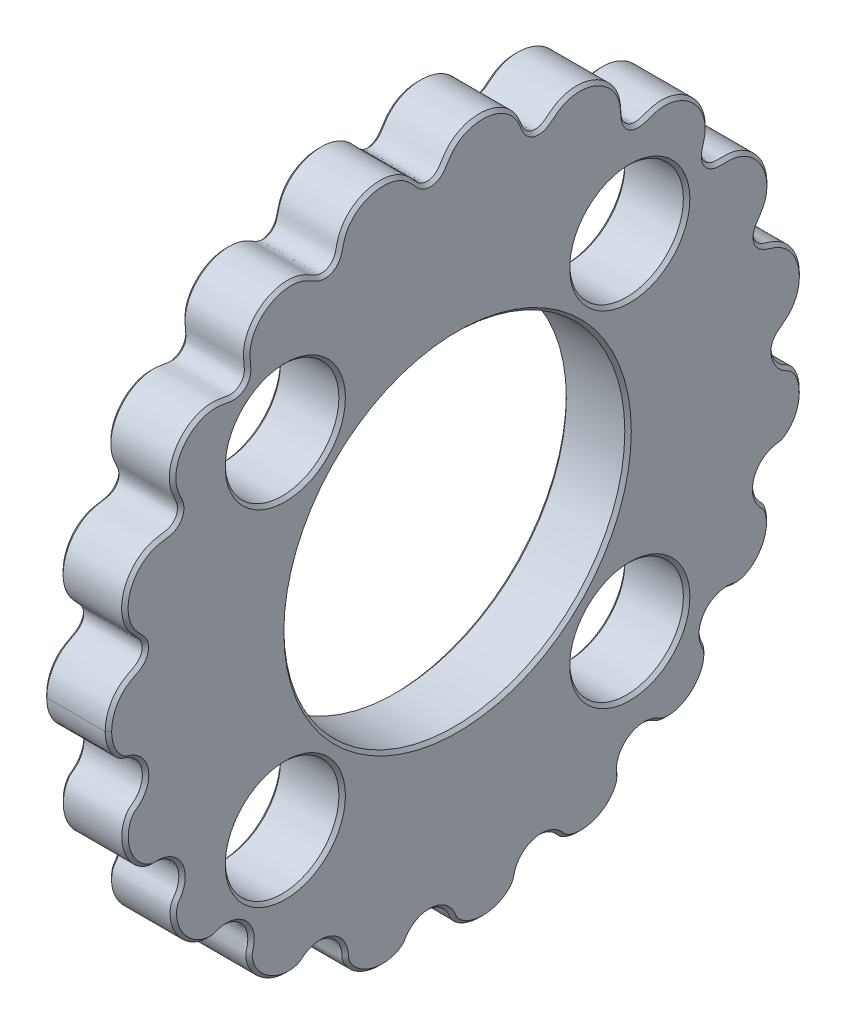
from build123d import *

# Parameters (mm, degrees)
SKETCH3_R           = 3.4999999999999996
SKETCH3_R_2         = 3.4999999999999982
SKETCH3_R_3         = 10.499999999999996
BOSS_EXTRUDE1_DEPTH = 4
CHAMFER1_SIZE       = 0.2


with BuildPart() as part:
    # Sketch3 → Boss-Extrude1 (new body)
    with BuildSketch(Plane(origin=(0, 0, 0), x_dir=(0, 0, -1), z_dir=(1, 0, 0))):
        with BuildLine():
            add(Edge.make_bspline(
                [(19.499999999999975, 3.329884417e-07), (19.499999999999975, -0.02287230945377665), (19.501229996833807, -0.06835144286155047), (19.506764992747904, -0.16754038275533853), (19.521487716763982, -0.2580209971098714), (19.543480268061113, -0.36881297082766035), (19.572630771735337, -0.4664537346469855), (19.60879615142777, -0.567791824809307), (19.651789624711995, -0.6632999383626808), (19.714132288668676, -0.7810693011824871), (19.802123499274355, -0.9144079510635557), (19.905487765368555, -1.0376345734967405), (20.02247229811794, -1.1477140826825898), (20.127883830321927, -1.23026548489148), (20.21638550502787, -1.2903536252035084), (20.309627016582475, -1.3451569315202483), (20.406485287855816, -1.394770335242422), (20.50719465216759, -1.4399198443744707), (20.59860271403629, -1.5037334733794454), (20.702594511579242, -1.5958084287050176), (20.813570665973955, -1.7204619686803277), (20.951910949920784, -1.9188697785914708), (21.091865071365625, -2.2037345686619907), (21.199089135309986, -2.5524694076271164), (21.252984017900896, -2.9607634620627894), (21.24195814277644, -3.3883117410404178), (21.159648671579774, -3.824579259899284), (20.999344174619836, -4.256158112798461), (20.78466013547445, -4.613893456089248), (20.551841067158822, -4.88465713142394), (20.319649860063095, -5.08204728659998), (20.147971438508993, -5.190189950025972), (20.0018465576917, -5.256235887602332), (19.88904249956997, -5.2886297800237925), (19.823016743996046, -5.300039515099961), (19.739803315911633, -5.309103893813168), (19.64034520844874, -5.322957876235482), (19.492613380585045, -5.353200067350046), (19.239603757466135, -5.43439155832235), (18.919287115207638, -5.613441115160358), (18.60866084535488, -5.9328746437024185), (18.399823038818454, -6.3710126916030125), (18.343377121818513, -6.772942029709708), (18.375358623535757, -7.097589519220558), (18.45239445057881, -7.357772668787995), (18.54327055448347, -7.55600780539964), (18.647619250972834, -7.7182570063137685), (18.75381430830691, -7.848236946865188), (18.85335026917537, -7.950082777091329), (18.938836225776676, -8.031385638833923), (19.005706643286548, -8.129006847120406), (19.06174796371881, -8.232343669920137), (19.11937144698086, -8.367851309748609), (19.185265309742054, -8.581297131572022), (19.231642426441926, -8.878251232050761), (19.227170867023894, -9.255241834436665), (19.149158342009496, -9.671630553658584), (19.001308503593624, -10.080304128009578), (18.783632002674665, -10.469626684813424), (18.496493654796822, -10.825786264185021), (18.141045028345413, -11.131991655470824), (17.806174446906024, -11.320269007481196), (17.52454050640761, -11.418108716242509), (17.316091860878064, -11.45561326874725), (17.18986873175847, -11.46592728562895), (17.062758742075072, -11.459868508465133), (16.93988492706201, -11.42793666140127), (16.784020037465467, -11.4013350279623), (16.59434373397104, -11.386250091096047), (16.372156605715546, -11.399323200639946), (16.061985501982278, -11.469436337301536), (15.728730478959532, -11.628186639375828), (15.410197064764583, -11.902601814291726), (15.166005134049836, -12.300372052313278), (15.066077010775238, -12.681240584481177), (15.0616536901558, -13.015215128468423), (15.105851881600806, -13.261803650430771), (15.15562664186265, -13.424752302557744), (15.205208549053072, -13.545300702443578), (15.243694405135681, -13.627115099206286), (15.285251390684238, -13.70745604639544), (15.329873493367348, -13.81984404953803), (15.361074000114298, -13.983771877870042), (15.371794431908645, -14.244097798114561), (15.323416880416595, -14.581476394351373), (15.201774992133414, -14.951545153750885), (14.99175036538002, -15.336511927592221), (14.718830007551794, -15.682935730194636), (14.390617047628089, -15.98218507810921), (14.015057318833543, -16.22478425264884), (13.652056551315157, -16.378363309697612), (13.32472090763043, -16.45957380099728), (13.070361999580625, -16.485893510599173), (12.895997979484859, -16.486004406743366), (12.74704726487107, -16.472470459398583), (12.624835044777388, -16.449694476259985), (12.504412844827472, -16.416564745005726), (12.391429717243987, -16.363425285131033), (12.287613402425322, -16.294480746837987), (12.176937157346304, -16.23746528153187), (12.063868167458645, -16.186368642835397), (11.946934261535072, -16.145506244843272), (11.797961603721701, -16.105613765227478), (11.615118661304155, -16.077373586776393), (11.398949112941555, -16.073126794497604), (11.100418616109161, -16.116088884477946), (10.764457394901738, -16.239773814236155), (10.427112842736264, -16.476626459818625), (10.179140928681162, -16.799355585111762), (10.044124624260599, -17.11593592514342), (9.984496226705057, -17.397811379174257), (9.973476180271238, -17.603154360238936), (9.983571034344273, -17.782493573097717), (10.009341888941961, -17.934290692396118), (10.00957383817889, -18.057736310768114), (9.990903990195946, -18.179613409453303), (9.961966157281509, -18.2990758472193), (9.914245299234244, -18.439532528296297), (9.84376902903685, -18.59807926549862), (9.717135199083561, -18.819436426286828), (9.510830090515586, -19.085644126481), (9.224157164160713, -19.355362950704), (8.850924927445984, -19.600943239878582), (8.444639131404681, -19.78061484299426), (8.017244402371128, -19.890606402995026), (7.57943319567193, -19.927435877585285), (7.192037901027372, -19.88893383945879), (6.86451007596446, -19.79712618264644), (6.632454357306686, -19.682256128355874), (6.48341495441103, -19.580510796517043), (6.382788785125926, -19.469549559264163), (6.308485908373052, -19.37634572204253), (6.204919184378785, -19.271305758406694), (6.072508879873373, -19.156566051379514), (5.9023225647692925, -19.04438638394573), (5.692407193251576, -18.946696326708174), (5.417395778581255, -18.866879606389183), (5.076052473850909, -18.838435231274907), (4.6712911634664005, -18.906330989559837), (4.302086158066921, -19.094844905106537), (4.034142539023349, -19.336334520539918), (3.853010610427224, -19.588406948647325), (3.755341977838242, -19.785065867178943), (3.694182483712389, -19.964964684285803), (3.6578592740915887, -20.121051554131384), (3.635894637654867, -20.247879930943043), (3.585508678111304, -20.3668849085039), (3.5231479058070163, -20.478837562207463), (3.434875642737918, -20.60527031078799), (3.317643343211058, -20.741360684202036), (3.1251919288314745, -20.921086387908247), (2.8392828135351, -21.11816851414157), (2.4722091893724745, -21.29119263577315), (2.031759555694021, -21.40903047716956), (1.5853149683359111, -21.450666171764972), (1.1456960982147835, -21.419100910302227), (0.7241735900222745, -21.3170885615711), (0.3735603176483722, -21.162017952178232), (0.09633428657242522, -20.977589398638106), (-0.08680452733857426, -20.803325310099783), (-0.19544179310044416, -20.66772569586649), (-0.2653119008589742, -20.54092414934849), (-0.30233114028752284, -20.43131288545926), (-0.35824742929314773, -20.302235215530832), (-0.4357067978776058, -20.15506717176089), (-0.5755406378212916, -19.952248783705326), (-0.8095816757843036, -19.72014391409475), (-1.142868041125582, -19.520053001138848), (-1.5298184705020847, -19.420943711717598), (-1.8832789977994735, -19.42158623736495), (-2.1823651942007993, -19.486265155674097), (-2.423535952495873, -19.58373122352189), (-2.6177454107348668, -19.703999966243686), (-2.7683413820419775, -19.82998751872537), (-2.8818924912930473, -19.94899706554997), (-2.9651005057896285, -20.052610873501113), (-3.0307630587168473, -20.148613685323816), (-3.08151040322101, -20.234272585462357), (-3.131848560635136, -20.32031883761394), (-3.214884461194451, -20.424537908796303), (-3.346299205858954, -20.54128742291917), (-3.5280915812365925, -20.660730993950878), (-3.8009481818691504, -20.789644131384872), (-4.139644055507957, -20.890292758555983), (-4.549510793861524, -20.94029617448333), (-5.00551738543772, -20.912353008594433), (-5.435917489994843, -20.811915761514957), (-5.831023879190455, -20.64968846453274), (-6.1835425843164895, -20.435018746913816), (-6.460207870643753, -20.194912777958276), (-6.647120269286063, -19.971559143659356), (-6.762049142269534, -19.789026588639803), (-6.825880108205394, -19.6633735330485), (-6.8684250036017875, -19.55901418125623), (-6.901973685666203, -19.451232038409113), (-6.92026589168495, -19.339620336012583), (-6.920173001232836, -19.22724828289659), (-6.928704794366817, -19.115996412471333), (-6.943160525530169, -19.005776139105148), (-6.965329085273686, -18.897404103832024), (-7.002307046620191, -18.764150583562586), (-7.061779675708556, -18.609031023016993), (-7.175965058673441, -18.393049986947865), (-7.378247895741575, -18.14050775470517), (-7.645599848258114, -17.932626455281806), (-7.966531643255652, -17.791503281727945), (-8.27264790584938, -17.729172159856603), (-8.54789129233259, -17.72378091691189), (-8.786232549815997, -17.76238696985816), (-8.983100683316987, -17.825871767099382), (-9.140304380626015, -17.897767499621196), (-9.26047781998533, -17.967098403776983), (-9.375575351944832, -18.045386087981054), (-9.48143911925773, -18.13468588388963), (-9.586713163091648, -18.22609092843788), (-9.711477076833708, -18.289392353086395), (-9.865933829664995, -18.34958827280036), (-10.054475723662359, -18.395508671600396), (-10.273445100505931, -18.42263427894083), (-10.521727136537752, -18.422182512047726), (-10.82971697287408, -18.387728810370554), (-11.190998674918708, -18.295757541594018), (-11.586257671859638, -18.12438451349737), (-11.991382994223756, -17.852404669274613), (-12.337865088762689, -17.515590002026826), (-12.578866222447154, -17.17326881571032), (-12.732815698293201, -16.849302206869837), (-12.80912259266666, -16.58794576442956), (-12.84103459750453, -16.403083339756463), (-12.847679287775279, -16.242140287545844), (-12.840761965686314, -16.105385156968442), (-12.80115457728268, -15.974963852637913), (-12.762013705584204, -15.845140218900319), (-12.736108441845145, -15.711523066009692), (-12.71997789938583, -15.57669305040338), (-12.713331409270031, -15.340927125925848), (-12.762020601887702, -15.006217868071076), (-12.9286864261791, -14.623262867838669), (-13.26030087815191, -14.261201570820521), (-13.613146217406253, -14.058519528284544), (-13.92282662020868, -13.967701296866128), (-14.187385328162115, -13.941527352050644), (-14.397855418595046, -13.949450571562442), (-14.581906116649622, -13.982146863109538), (-14.738924506498678, -14.027589117810132), (-14.868797074620577, -14.078662992494792), (-14.977192266389975, -14.1216945454198), (-15.092608189700728, -14.14098819217288), (-15.208431572086543, -14.149737854486958), (-15.35400991538781, -14.146747254488927), (-15.57423420237398, -14.120318419361094), (-15.863086159833246, -14.04262991477303), (-16.204884402208197, -13.886646225508564), (-16.553550281083545, -13.647579797719015), (-16.86756211126879, -13.347676631778306), (-17.13588532252412, -12.991497716773303), (-17.346253094355273, -12.58461232318562), (-17.482747856441662, -12.135106428143247), (-17.523256638752237, -11.717850667267141), (-17.487234024737916, -11.385554866974205), (-17.413712398587663, -11.147426152473336), (-17.33559821232397, -11.00256950750292), (-17.253192390951995, -10.90010723447597), (-17.166172202876048, -10.761181773114924), (-17.07751875825349, -10.58764851280511), (-17.004828389567308, -10.37331140898559), (-16.95300874861338, -10.056860304669218), (-16.975391204152174, -9.690767044899282), (-17.107962810258105, -9.297630771737959), (-17.381469359202562, -8.922309600522842), (-17.69476643099147, -8.684402412326083), (-18.0059259381502, -8.55165938496039), (-18.257676816779696, -8.498334067189338), (-18.430446760403353, -8.483957464294454), (-18.576830850067402, -8.48325196098362), (-18.696291074800936, -8.49415572785092), (-18.8459694927804, -8.48221541688931), (-19.02004153909573, -8.435093126186842), (-19.256538583701825, -8.334829457894966), (-19.53726778118809, -8.152387022870135), (-19.81769794022687, -7.8935544529872335), (-20.076625840973932, -7.551951342289513), (-20.279715365235734, -7.166455873544541), (-20.42006314008765, -6.745751337354278), (-20.48985493506592, -6.300112567856838), (-20.481207653638876, -5.898539389469338), (-20.41882324316543, -5.560608917507923), (-20.33547822043518, -5.314848800218689), (-20.26181606621446, -5.155649741774989), (-20.18683456315623, -5.026668344797717), (-20.115256615631896, -4.927695857285754), (-20.035301545087677, -4.834002138855096), (-19.938127904103897, -4.759051473020707), (-19.836535895980912, -4.6909346407148345), (-19.74220358147565, -4.612674644960762), (-19.629186308621218, -4.507082785343819), (-19.50701907935731, -4.364923014997262), (-19.386941886623255, -4.180461545036984), (-19.286031302679188, -3.9488024878385137), (-19.21507388614972, -3.66554573585125), (-19.200220223221887, -3.3332205248544136), (-19.261569524551692, -3.016369627364003), (-19.38725984376836, -2.73305170616435), (-19.532693662047194, -2.51971622560051), (-19.67196666781302, -2.3656631083957094), (-19.830448110538104, -2.2321352018664657), (-19.983343951462615, -2.135243323393579), (-20.12212868286469, -2.0670562094287206), (-20.241814201843074, -2.0206668304555326), (-20.339172229997047, -1.9882049474646957), (-20.438748674397267, -1.9626339568977524), (-20.534065822701155, -1.923748993362187), (-20.635086506707566, -1.8649215199069444), (-20.74106041224381, -1.7883776534031404), (-20.878831902993692, -1.6656828585839336), (-21.03572293542551, -1.4859662871936574), (-21.189282899599437, -1.2540200026231705), (-21.314003440789445, -0.9913255997274952), (-21.398890221573467, -0.7437177135429477), (-21.44734116004922, -0.5393203026336444), (-21.47334392820881, -0.38841130372841975), (-21.488342226553048, -0.2556119762425632), (-21.496335931475116, -0.1623452446439793), (-21.4993338223915, -0.06761080760295489), (-21.49999999919133, -0.02242027775518435), (-21.50000000000001, 2.363204427e-07)],
                knots=[0.06742672404055065, 0.06742672404055065, 0.06742672404055065, 0.06742672404055065, 0.06742672404055065, 0.06857526503569406, 0.0697238102110965, 0.07087235538649893, 0.07202090056190136, 0.07316944573730379, 0.07431799091270622, 0.07546653608810866, 0.07661508126351109, 0.07894233574718174, 0.08126959023085238, 0.0824332174726877, 0.08359684471452303, 0.08476047195635836, 0.08592409919819367, 0.08713122716345095, 0.08833835512870825, 0.08954548309396552, 0.0907526110592228, 0.09316686698973738, 0.09558112292025195, 0.1000416543963477, 0.10450218587244345, 0.10896271734853921, 0.11342324882463496, 0.11857825663663443, 0.12373326444863392, 0.12888827226063337, 0.13146577616663313, 0.13404328007263286, 0.13695584131741328, 0.1376839816286084, 0.1384121219398035, 0.13914026225099863, 0.1398684025621937, 0.1413246831845839, 0.14278096380697414, 0.14569352505175456, 0.15140029479194717, 0.1571070645321398, 0.16178427475767204, 0.16646148498320432, 0.16882523086595524, 0.1711889767487062, 0.17355272263145716, 0.1759164685142081, 0.17719549018423109, 0.17847451185425406, 0.17975353352427703, 0.18103255519429998, 0.18231157686432292, 0.1835905985343459, 0.18614864187439184, 0.19073523879291113, 0.1953218357114304, 0.1999084326299497, 0.204495029548469, 0.2095679897677511, 0.21464094998703323, 0.21971391020631537, 0.22478687042559747, 0.22616281853657844, 0.22753876664755943, 0.22891471475854042, 0.23029066286952138, 0.23166661098050237, 0.23304255909148336, 0.2357944553134453, 0.23855039436209224, 0.2413063334107392, 0.24681821150803313, 0.2516809340381474, 0.2565436565682617, 0.2613203417364751, 0.2637086843205818, 0.2660970269046885, 0.2674083132727255, 0.2687195996407626, 0.2693752428247811, 0.27003088600879965, 0.27134217237683667, 0.27396474511291075, 0.2765873178489848, 0.2813322149876236, 0.2860771121262624, 0.2908220092649012, 0.29556690640354005, 0.3004401960403346, 0.3053134856771292, 0.31018677531392375, 0.31262342013232103, 0.3150600649507183, 0.3164128024351728, 0.3177655399196273, 0.31911827740408183, 0.32047101488853635, 0.3218237523729909, 0.32317648985744535, 0.3245292273418998, 0.32588196482635434, 0.3272201077931269, 0.3285582507598994, 0.3312345366934445, 0.33391082262698957, 0.3365871085605347, 0.3416252435854473, 0.3466633786103599, 0.3515704326854172, 0.35402395972294587, 0.3564774867604746, 0.3591511919083717, 0.36048804448232025, 0.3618248970562688, 0.36316174963021736, 0.3644986022041659, 0.36583545477811447, 0.367172307352063, 0.36960559809489724, 0.3720388888377315, 0.37690547032339994, 0.38177205180906837, 0.3866386332947368, 0.39139111659385917, 0.3961435998929816, 0.400896083192104, 0.4056485664912264, 0.4082442458006671, 0.4108399251101078, 0.41213776476482816, 0.4134356044195485, 0.41473344407426893, 0.4160312837289893, 0.4185416079647096, 0.42105193220042997, 0.4235622564361503, 0.42607258067187065, 0.4309509207383144, 0.4358292608047582, 0.4411584116370564, 0.4438229870532055, 0.4464875624693546, 0.4492775570138713, 0.4506725542861296, 0.45206755155838796, 0.4534625488306463, 0.45485754610290463, 0.45625254337516297, 0.45764754064742136, 0.4601553894641598, 0.46266323828089817, 0.46767893591437504, 0.47269463354785185, 0.47771033118132866, 0.48240406415202886, 0.4870977971227291, 0.49179153009342935, 0.49648526306412955, 0.498994178475154, 0.5015030938861784, 0.5027575515916907, 0.5040120092972029, 0.5052664670027152, 0.5065209247082273, 0.5088783059872031, 0.511235687266179, 0.5159504498241307, 0.5207535976574469, 0.5255567454907629, 0.5283726046762773, 0.5311884638617919, 0.5340043230473064, 0.5368201822328208, 0.5382643529712738, 0.539708523709727, 0.5411526944481801, 0.5425968651866333, 0.5433189505558599, 0.5440410359250865, 0.5454852066635395, 0.5483735481404457, 0.5509246293965806, 0.5534757106527154, 0.5585778731649851, 0.5636800356772547, 0.5687821981895244, 0.5732521832581763, 0.5777221683268283, 0.5821921533954802, 0.5866621384641322, 0.5891123215379016, 0.5903374130747863, 0.591562504611671, 0.5927875961485558, 0.5940126876854406, 0.5952377792223253, 0.59646287075921, 0.5976652946988608, 0.5988677186385114, 0.600070142578162, 0.6012725665178127, 0.603677414397114, 0.6060822622764153, 0.6106631674611567, 0.615244072645898, 0.6182230161327041, 0.6212019596195103, 0.6241809031063165, 0.6271598465931226, 0.6286691050530335, 0.6301783635129445, 0.6316876219728556, 0.6331968804327666, 0.6347061388926776, 0.6362153973525886, 0.6377246558124996, 0.6392339142724105, 0.6419265674782795, 0.6446192206841485, 0.6473118738900174, 0.6500045270958864, 0.6553898335076244, 0.6607751399193623, 0.665949490608613, 0.6711238412978637, 0.6762981919871145, 0.6788853673317399, 0.6814725426763651, 0.6829491778619678, 0.6844258130475706, 0.6859024482331733, 0.687379083418776, 0.6888557186043787, 0.6903323537899814, 0.6918089889755841, 0.6932856241611868, 0.6991032806094032, 0.7049209370576196, 0.709604404162876, 0.7142878712681324, 0.7165710868699332, 0.718854302471734, 0.7211375180735349, 0.7234207336753357, 0.7246852719645209, 0.7259498102537062, 0.7272143485428915, 0.7284788868320767, 0.729743425121262, 0.7310079634104473, 0.7335370399888178, 0.7381145370682876, 0.7426920341477573, 0.7472695312272271, 0.7518470283066968, 0.7569288245846095, 0.7620106208625221, 0.7670924171404349, 0.7721742134183476, 0.775024564777769, 0.7764497404574797, 0.7778749161371905, 0.7793000918169013, 0.780725267496612, 0.7835756188560334, 0.7863363225385618, 0.78909702622109, 0.7946184335861466, 0.7993584426313578, 0.8040984516765689, 0.8090262042093547, 0.8114900804757476, 0.8139539567421404, 0.8152549575783476, 0.816555958414555, 0.8178569592507622, 0.8191579600869694, 0.8217599617593839, 0.8243619634317985, 0.829001152159631, 0.8336403408874634, 0.8382795296152958, 0.8429187183431284, 0.8478834856311608, 0.8528482529191932, 0.8578130202072256, 0.8602954038512418, 0.862777787495258, 0.8641084690219264, 0.8654391505485948, 0.8667698320752633, 0.8681005136019316, 0.8694311951286, 0.8707618766552685, 0.8720925581819369, 0.8734232397086052, 0.8761587571369028, 0.8788942745652004, 0.8816297919934979, 0.8843653094217955, 0.8888081568321564, 0.8932510042425174, 0.8955032308718964, 0.8977554575012754, 0.9000076841306544, 0.9022599107600334, 0.9044925212387498, 0.9056088264781079, 0.9067251317174662, 0.9078414369568244, 0.9089577421961825, 0.9100740474355407, 0.9111903526748989, 0.9129145394165368, 0.9146387261581745, 0.9180870996414503, 0.9215354731247261, 0.9249838466080017, 0.927235529887418, 0.9294872131668341, 0.9306130548065422, 0.9317388964462503, 0.9328647380859585, 0.9339905767545582, 0.9339905767545582, 0.9339905767545582, 0.9339905767545582, 0.9339905767545582], degree=4))
            add(Edge.make_bspline(
                [(19.499999999999975, 3.329884417e-07), (19.499999999980815, 0.00693842470733998), (19.500217496612237, 0.02084398732890852), (19.501196230422288, 0.04535259060889237), (19.503804156988494, 0.08108974752194885), (19.508687587126204, 0.12397791655168573), (19.5171325954883, 0.17182890460717695), (19.530716992951426, 0.22761196082915336), (19.55124596851782, 0.29051486057064596), (19.58295791231204, 0.3664476583420515), (19.632560045278172, 0.45776894040639543), (19.706316311620355, 0.5592306318832981), (19.80828422294335, 0.6647301114799387), (19.924139742492635, 0.7620737974095453), (20.044931667400636, 0.8530290513215487), (20.16657512526189, 0.9427943210082822), (20.3161553658492, 1.058343634403528), (20.50512010342224, 1.2221658201638395), (20.716743334349797, 1.4511966749048153), (20.92494756108271, 1.7610347237302675), (21.090421670407405, 2.1210692105232236), (21.199642877569644, 2.5032566174525193), (21.252187173660605, 2.8984848944590595), (21.247216241110653, 3.398919315169449), (21.148688774624635, 3.893024712250063), (20.959864578852134, 4.360515771175375), (20.685169940924876, 4.780627103191222), (20.41689174888264, 5.0797147098194015), (20.120347739854072, 5.317693101389944), (19.810040617992396, 5.496492786086577), (19.497558229816832, 5.6208796578165146), (19.1986133128946, 5.713345121470486), (18.8465112314293, 5.827838442910737), (18.49925241367852, 6.092672871650264), (18.344615618627596, 6.519701093682414), (18.436442116411474, 6.94006086964333), (18.630740950018613, 7.244026950844603), (18.804689568619878, 7.48950897317587), (18.9759879594926, 7.7672402101048705), (19.118202500931382, 8.086110274094308), (19.243025856126366, 8.541380356968533), (19.274262823820973, 9.140718664061694), (19.136728192700698, 9.832696058706286), (18.76645079809617, 10.550875997226516), (18.27933265294612, 11.067498932408798), (17.768008717120146, 11.393446026493388), (17.316423675962795, 11.559072188751587), (16.964948565714025, 11.62937293227197), (16.62898091487679, 11.647170537397812), (16.315766250680795, 11.638299788413033), (15.945777286851971, 11.630148272576497), (15.52937104603442, 11.761437960013332), (15.239362742798773, 12.110870526511581), (15.183057657741248, 12.537350069610955), (15.26533973663865, 12.88863012661935), (15.350485276220857, 13.176752005496049), (15.423596350119952, 13.494502853617115), (15.456583859355717, 13.841694104628896), (15.429595645004722, 14.312578172728783), (15.267891695377866, 14.89026730718507), (14.91635743161823, 15.501968403366128), (14.335650569855632, 16.06410333490407), (13.708473254068284, 16.397937476266844), (13.119405778748062, 16.543391567330378), (12.638306374068451, 16.556087075281702), (12.282497923882401, 16.51042131131493), (11.958397710715197, 16.419657850458144), (11.664379803829936, 16.310180884041333), (11.317877512287938, 16.18057410504068), (10.87910312243113, 16.162728671419956), (10.48819974847597, 16.395259562990194), (10.293721721264896, 16.775721320225312), (10.254290935644356, 17.128733017486965), (10.241646233814267, 17.41819818690422), (10.21160887256101, 17.73648905318031), (10.136067329393963, 18.075232788552807), (9.962722431864162, 18.51920794788478), (9.620188259643484, 19.027594885561268), (9.0784812614239, 19.505653549615488), (8.422010234571045, 19.81173010860383), (7.811990770711981, 19.933244702131777), (7.296006302536649, 19.93120030439843), (6.888373946240667, 19.865132783915357), (6.52148679126579, 19.739931912853894), (6.201923124750547, 19.57117424404322), (5.9298582267630975, 19.374256239100237), (5.693555686777136, 19.176345817658884), (5.400578007027449, 18.948300997838764), (4.983454623436344, 18.81834446021791), (4.548512421187868, 18.939159842622804), (4.262200305553063, 19.25203112035506), (4.121443757509707, 19.570751032185726), (4.014653368284693, 19.839222652347708), (3.8811203556175062, 20.124619759461698), (3.6990480653827356, 20.411279426887408), (3.3965132902621997, 20.76047159029014), (2.9201329512612513, 21.118301529438835), (2.2690963433259266, 21.390467328944826), (1.4617236492352024, 21.48360162858222), (0.7523981091332773, 21.36295146724718), (0.19105171874955434, 21.113372786554592), (-0.20186857994289573, 20.822820175287607), (-0.45822645338408513, 20.5621275342276), (-0.6614118219291472, 20.283311312651712), (-0.8286864890205424, 20.007961921989644), (-1.0321210490714936, 19.687405529281904), (-1.3848271605621605, 19.42072262269646), (-1.8361578652262855, 19.388512375354846), (-2.2097935607661405, 19.584645273023128), (-2.448259267672147, 19.838746090971338), (-2.635832085688203, 20.057913830827104), (-2.853681862636474, 20.285248349661043), (-3.1174274749842543, 20.498544650408252), (-3.5152331031791646, 20.732718444809944), (-4.08069419734254, 20.91962133410803), (-4.7845741206372745, 20.969382918037926), (-5.579511099898053, 20.79929438960938), (-6.213315427175049, 20.45784411012257), (-6.665679174959722, 20.04163337963896), (-6.945324867456741, 19.640569062231137), (-7.105150994089426, 19.311403548249153), (-7.208343471111343, 18.982073145989713), (-7.27806364825163, 18.667117745667547), (-7.364050911489696, 18.29750402493643), (-7.605244850181123, 17.927059120369883), (-8.019022643798959, 17.743992364504443), (-8.436932641415886, 17.801693301599165), (-8.74624796758815, 17.962241978412525), (-8.994271646617971, 18.108734307628783), (-9.273329996621937, 18.254038315266502), (-9.591001538906541, 18.371859591368764), (-10.04234252965673, 18.466740075209508), (-10.63763111593939, 18.46331092903898), (-11.320484134644015, 18.285439823975118), (-12.019404321698618, 17.8698820388962), (-12.51092490914557, 17.343282871377237), (-12.806643916882644, 16.803964713908424), (-12.943566188352968, 16.334317622977114), (-12.98995502648169, 15.97109224142213), (-12.982226136903332, 15.625883042600517), (-12.946748086413796, 15.304946614949458), (-12.905899134173172, 14.92769273221419), (-13.007698204421342, 14.495066863836652), (-13.341529614351433, 14.178771425630893), (-13.765602858742863, 14.095848374726424), (-14.122019870722383, 14.152562907361084), (-14.416771548819458, 14.21313123775004), (-14.740131106304935, 14.257981007429091), (-15.089370885008895, 14.259447645405189), (-15.55645715040743, 14.18994410533143), (-16.117528667178437, 13.976706462752079), (-16.695268657222638, 13.571770076292996), (-17.20310822897515, 12.943383333250695), (-17.47939079450813, 12.289433575682558), (-17.57141175489553, 11.690210319854735), (-17.540807665737287, 11.210272338574299), (-17.463361305741717, 10.860404560450737), (-17.344232289623097, 10.545805415001936), (-17.210110009056365, 10.262774748113118), (-17.054626325433254, 9.926881441854363), (-17.009810848029023, 9.492537083740167), (-17.215303642259993, 9.087565687350907), (-17.58442658437556, 8.86659363296209), (-17.93934213722821, 8.801800412740864), (-18.23751595839309, 8.763871661371516), (-18.557876326798468, 8.702726989401258), (-18.888977878919306, 8.592778533662061), (-19.309074540900067, 8.378030369933894), (-19.772479969345497, 7.996955978735749), (-20.190470364941472, 7.428575885998858), (-20.470647714812685, 6.670559962529333), (-20.523285281125922, 5.9621637777578105), (-20.418748746785838, 5.364588201330365), (-20.236468803487703, 4.919333020403192), (-20.050937335877048, 4.61225920413803), (-19.837718218216036, 4.352301022310232), (-19.61847011241818, 4.127285967783315), (-19.36220565725631, 3.8615995868381594), (-19.20063708707543, 3.529542581937176), (-19.210414492495975, 3.169559752244185), (-19.355179893043264, 2.86362626171498), (-19.545778489229228, 2.6644443272382903), (-19.780935730568004, 2.5221249782632946), (-20.030497647977846, 2.3995739639614526), (-20.300436338569458, 2.2534621249768936), (-20.576884887312872, 2.0610168652995298), (-20.842888201763948, 1.809187470498787), (-21.081966735248866, 1.4945771890326698), (-21.25182688618291, 1.1796839348993122), (-21.355393957632238, 0.9098613241483707), (-21.41520859771544, 0.6968197262666985), (-21.447971461550143, 0.5480101909074345), (-21.468948068282394, 0.4257561591410603), (-21.482723022568727, 0.3230992809710346), (-21.49125103680255, 0.22462863754031046), (-21.4971564094585, 0.1474544293106524), (-21.49934383454956, 0.06439894242292343), (-21.49999999904583, 0.02579504746763896), (-21.50000000000001, 2.363204427e-07)],
                knots=[0.07919164041425533, 0.07919164041425533, 0.07919164041425533, 0.07919164041425533, 0.07919164041425533, 0.07954295364376676, 0.07989426830850435, 0.08024558297324193, 0.0805968976379795, 0.08129952696745467, 0.08200215629692983, 0.082704785626405, 0.08340741495588017, 0.08481267361483048, 0.08642608145415093, 0.08803948929347138, 0.08965289713279183, 0.09126630497211227, 0.09287971281143273, 0.09449312065075317, 0.09771993632939407, 0.10193126133076348, 0.10614258633213289, 0.11035391133350231, 0.11456523633487171, 0.11883470746178637, 0.12310417858870104, 0.13164312084253038, 0.13591263338709916, 0.14018214593166795, 0.14445165847623673, 0.1487211710208055, 0.15206799520643066, 0.15541481939205581, 0.15876164357768097, 0.1621084677633061, 0.16780702221667357, 0.17342292791498046, 0.17664666444965893, 0.1798704009843374, 0.18309413751901588, 0.18631787405369435, 0.19052518660978912, 0.19473249916588392, 0.2031471242780735, 0.21169144848299792, 0.22023577268792233, 0.22878019389263154, 0.23305240449498615, 0.23732461509734074, 0.2406735886291485, 0.2440225621609563, 0.2473715356927641, 0.2507205092245719, 0.2564224270404676, 0.26203320891282017, 0.2652538905200952, 0.26847457212737025, 0.2716952537346453, 0.2749159353419204, 0.27911925275494354, 0.2833225701679667, 0.291729204994013, 0.30027888664676383, 0.3088285682995146, 0.31737835948164284, 0.3216532550727069, 0.32592815066377107, 0.32927926964628984, 0.33263038862880867, 0.33598150761132745, 0.3393326265938462, 0.34503787483414977, 0.35075541042614744, 0.35386120233687657, 0.3569669942476057, 0.3600727861583348, 0.363178578069064, 0.36746181607254214, 0.3717450540760202, 0.38031153008297636, 0.38908681339632445, 0.39786209670967254, 0.4022497774658297, 0.4066374582219869, 0.4110251389781441, 0.4154128197343012, 0.41871263659861, 0.4220124534629188, 0.4253122703272276, 0.4286120871915365, 0.4344668928573786, 0.43998563270963376, 0.44307803358580744, 0.4461704344619811, 0.4492628353381548, 0.45235523621432844, 0.45648994213715627, 0.4606246480599841, 0.46889405990563976, 0.477549252963707, 0.48620444602177415, 0.494859792127854, 0.49918746518089396, 0.5035151382339339, 0.5069630446710167, 0.5104109511080994, 0.5138588575451822, 0.517306763982265, 0.5230823093060973, 0.5285960205970318, 0.5316854299994707, 0.5347748394019096, 0.5378642488043486, 0.5409536582067874, 0.5450844313155797, 0.549215204424372, 0.5574767506419566, 0.566137173509554, 0.5747975963771512, 0.583458173220651, 0.5877884616424007, 0.5921187500641506, 0.5955687751366694, 0.5990188002091881, 0.6024688252817068, 0.6059188503542255, 0.6116976972398587, 0.6172063975345895, 0.6202928453055288, 0.6233792930764681, 0.6264657408474075, 0.6295521886183468, 0.6336790545574525, 0.6378059204965583, 0.6460596523747697, 0.654725269661871, 0.6633908869489722, 0.6720566583858532, 0.6763895441042936, 0.6807224298227341, 0.6841745648658463, 0.6876266999089584, 0.6910788349520707, 0.6945309699951828, 0.7003130780989576, 0.70593069265985, 0.7091554527899144, 0.7123802129199788, 0.7156049730500432, 0.7188297331801077, 0.7230383811514793, 0.727247029122851, 0.7356643250655942, 0.7442068581953437, 0.7527493913250932, 0.7612920169279718, 0.7655633297294111, 0.7698346425308504, 0.7731829000989654, 0.7765311576670804, 0.7798794152351953, 0.7832276728033102, 0.7889284733470512, 0.7945409628029436, 0.7977626601154354, 0.8009843574279272, 0.804206054740419, 0.8074277520529107, 0.8116323993941884, 0.8158370467354661, 0.8242463414180214, 0.8327942398034904, 0.8413421381889593, 0.8498901420925772, 0.8541641440443861, 0.8584381459961951, 0.861788550220266, 0.8651389544443369, 0.8684893586684078, 0.8718397628924788, 0.8775439044482395, 0.8803467057624981, 0.8831495070767568, 0.8861152924983817, 0.8890810779200067, 0.8920468633416316, 0.8950126487632565, 0.8992119072010285, 0.9034111656388006, 0.9076104240765727, 0.9118096825143447, 0.9144218542499096, 0.9157279401176921, 0.9170340259854746, 0.918340111853257, 0.9196461977210395, 0.9202992406549307, 0.920952283588822, 0.9222583694566043, 0.9222583694566043, 0.9222583694566043, 0.9222583694566043, 0.9222583694566043], degree=4))
        make_face()
        with Locations((-10.606601717798268, 10.606601717798153)):
            Circle(SKETCH3_R, mode=Mode.SUBTRACT)
        with Locations((10.606601717798153, 10.606601717798268)):
            Circle(SKETCH3_R, mode=Mode.SUBTRACT)
        with Locations((10.60660171779827, -10.606601717798151)):
            Circle(SKETCH3_R, mode=Mode.SUBTRACT)
        with Locations((-10.606601717798155, -10.606601717798267)):
            Circle(SKETCH3_R_2, mode=Mode.SUBTRACT)
        Circle(SKETCH3_R_3, mode=Mode.SUBTRACT)
    extrude(amount=BOSS_EXTRUDE1_DEPTH)

    # Chamfer1
    chamfer1_edges = [part.edges().sort_by_distance(p)[0] for p in [
        (0, -20.74597474372751, 0.12955037193555086),
        (4, -20.74597474372751, 0.12955037193555086),
        (0, 20.8380063916629, 0.16453438303718285),
        (4, 20.8380063916629, 0.16453438303718285),
        (0, 10.606601717798153, 14.106601717798268),
        (4, 10.606601717798153, 14.106601717798268),
        (0, 10.606601717798268, -7.106601717798153),
        (4, 10.606601717798268, -7.106601717798153),
        (0, -10.606601717798151, -7.10660171779827),
        (4, -10.606601717798151, -7.10660171779827),
        (0, -10.606601717798267, 14.106601717798153),
        (4, -10.606601717798267, 14.106601717798153),
        (0, 1.29e-15, 10.499999999999996),
        (4, 1.29e-15, 10.499999999999996),
    ]]
    chamfer(chamfer1_edges, length=CHAMFER1_SIZE)


solid = part.part
